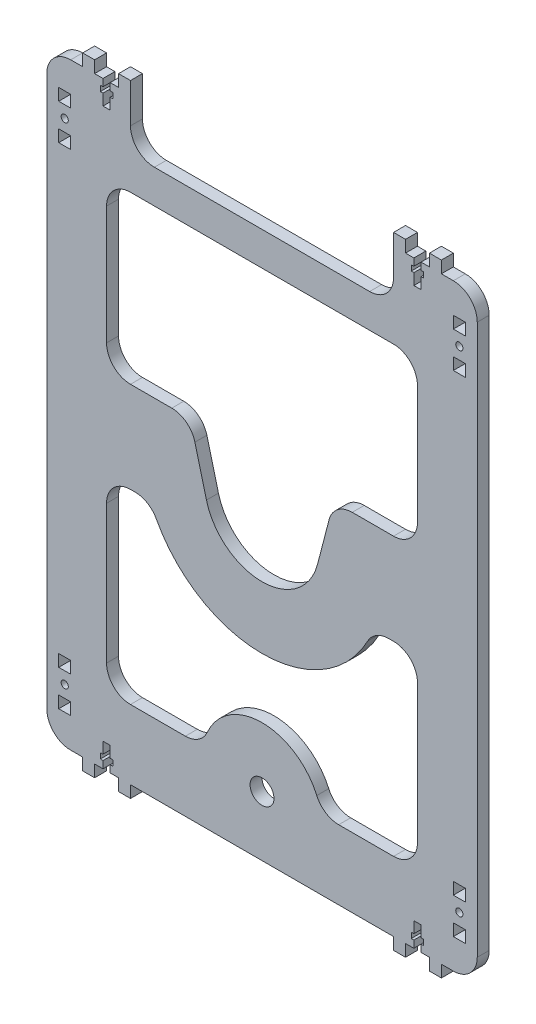
from build123d import *

# Parameters (mm, degrees)
SKETCH1_W           = 5
SKETCH1_H           = 5
SKETCH1_R           = 1.5
SKETCH1_R_2         = 5
BOSS_EXTRUDE1_DEPTH = 5
FILLET1_R           = 10


with BuildPart() as part:
    # Sketch1 → Boss-Extrude1 (new body)
    with BuildSketch(Plane.XY):
        Polygon((-75, 125), (-90, 125), (-90, -125), (-75, -125), (-75, -130), (-70, -130), (-70, -125), (-66.5, -125), (-66.5, -122), (-67.6, -122), (-67.6, -119.7), (-66.5, -119.7), (-66.5, -115), (-63.5, -115), (-63.5, -119.7), (-62.4, -119.7), (-62.4, -122), (-63.5, -122), (-63.5, -125), (-60, -125), (-60, -130), (-55, -130), (-55, -125), (55, -125), (55, -130), (60, -130), (60, -125), (63.5, -125), (63.5, -122), (62.4, -122), (62.4, -119.7), (63.5, -119.7), (63.5, -115), (66.5, -115), (66.5, -119.7), (67.6, -119.7), (67.6, -122), (66.5, -122), (66.5, -125), (70, -125), (70, -130), (75, -130), (75, -125), (90, -125), (90, 125), (75, 125), (75, 130), (70, 130), (70, 125), (66.5, 125), (66.5, 122), (67.6, 122), (67.6, 119.7), (66.5, 119.7), (66.5, 115), (63.5, 115), (63.5, 119.7), (62.4, 119.7), (62.4, 122), (63.5, 122), (63.5, 125), (60, 125), (60, 130), (55, 130), (55, 103.598832104), (-55, 103.598832104), (-55, 130), (-60, 130), (-60, 125), (-63.5, 125), (-63.5, 122), (-62.4, 122), (-62.4, 119.7), (-63.5, 119.7), (-63.5, 115), (-66.5, 115), (-66.5, 119.7), (-67.6, 119.7), (-67.6, 122), (-66.5, 122), (-66.5, 125), (-70, 125), (-70, 130), (-75, 130), align=None)
        with Locations((-82.5, -110)):
            Rectangle(SKETCH1_W, SKETCH1_H, mode=Mode.SUBTRACT)
        with Locations((-82.5, -102.5)):
            Circle(SKETCH1_R, mode=Mode.SUBTRACT)
        with Locations((-82.5, -95)):
            Rectangle(SKETCH1_W, SKETCH1_H, mode=Mode.SUBTRACT)
        with Locations((0, -100)):
            Circle(SKETCH1_R_2, mode=Mode.SUBTRACT)
        with Locations((82.5, -110)):
            Rectangle(SKETCH1_W, SKETCH1_H, mode=Mode.SUBTRACT)
        with Locations((82.5, -102.5)):
            Circle(SKETCH1_R, mode=Mode.SUBTRACT)
        with Locations((82.5, -95)):
            Rectangle(SKETCH1_W, SKETCH1_H, mode=Mode.SUBTRACT)
        with BuildLine():
            Line((-65, -18.081635275), (-46.616032283, -18.081635275))
            ThreePointArc((-46.616032283, -18.081635275), (0, -50), (46.616032283, -18.081635275))
            Line((46.616032283, -18.081635275), (65, -18.081635275))
            Line((65, -18.081635275), (65, -95.958016924))
            Line((65, -95.958016924), (24.671083738, -95.958016924))
            ThreePointArc((24.671083738, -95.958016924), (0, -75), (-24.671083738, -95.958016924))
            Line((-24.671083738, -95.958016924), (-65, -95.958016924))
            Line((-65, -95.958016924), (-65, -18.081635275))
        make_face(mode=Mode.SUBTRACT)
        with Locations((-82.5, 95)):
            Rectangle(SKETCH1_W, SKETCH1_H, mode=Mode.SUBTRACT)
        with Locations((-82.5, 102.5)):
            Circle(SKETCH1_R, mode=Mode.SUBTRACT)
        with Locations((-82.5, 110)):
            Rectangle(SKETCH1_W, SKETCH1_H, mode=Mode.SUBTRACT)
        with BuildLine():
            ThreePointArc((23.227291604, -6.040937406), (0, -24), (-23.227291604, -6.040937406))
            Line((-23.227291604, -6.040937406), (-30, 20))
            Line((-30, 20), (-65, 20))
            Line((-65, 20), (-65, 89.539551807))
            Line((-65, 89.539551807), (65, 89.539551807))
            Line((65, 89.539551807), (65, 20))
            Line((65, 20), (30, 20))
            Line((30, 20), (23.227291604, -6.040937406))
        make_face(mode=Mode.SUBTRACT)
        with Locations((82.5, 95)):
            Rectangle(SKETCH1_W, SKETCH1_H, mode=Mode.SUBTRACT)
        with Locations((82.5, 102.5)):
            Circle(SKETCH1_R, mode=Mode.SUBTRACT)
        with Locations((82.5, 110)):
            Rectangle(SKETCH1_W, SKETCH1_H, mode=Mode.SUBTRACT)
    extrude(amount=BOSS_EXTRUDE1_DEPTH)

    # Fillet1
    fillet1_edges = [part.edges().sort_by_distance(p)[0] for p in [
        (-90, -125, 2.5),
        (90, -125, 2.5),
        (-90, 125, 2.5),
        (90, 125, 2.5),
        (-55, 103.598832104, 2.5),
        (55, 103.598832104, 2.5),
        (24.671083738, -95.958016924, 2.5),
        (-24.671083738, -95.958016924, 2.5),
        (-65, -95.958016924, 2.5),
        (65, -95.958016924, 2.5),
        (65, -18.081635275, 2.5),
        (46.616032283, -18.081635275, 2.5),
        (-46.616032283, -18.081635275, 2.5),
        (-65, -18.081635275, 2.5),
        (65, 89.539551807, 2.5),
        (-65, 89.539551807, 2.5),
        (65, 20, 2.5),
        (-65, 20, 2.5),
        (30, 20, 2.5),
        (-30, 20, 2.5),
    ]]
    fillet(fillet1_edges, radius=FILLET1_R)


solid = part.part
